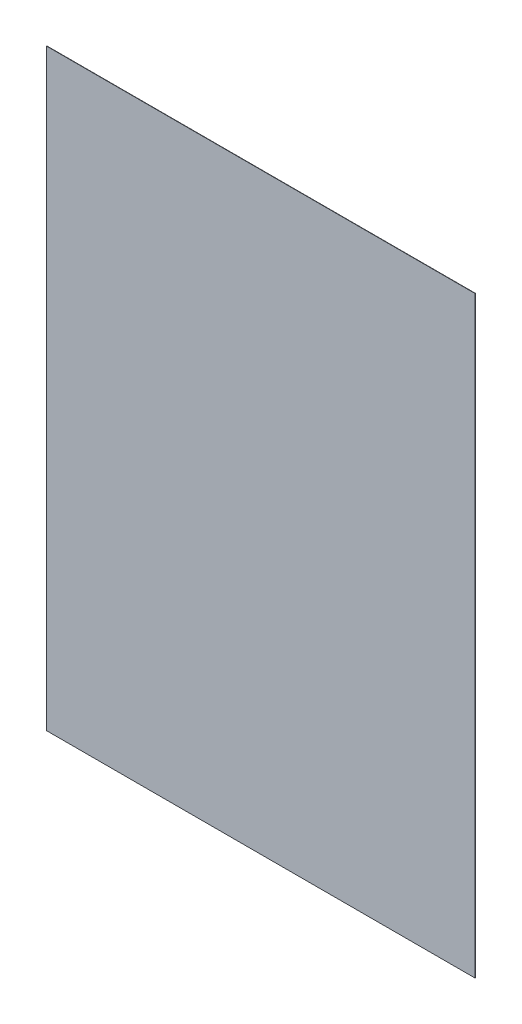
from build123d import *

# Parameters (mm, degrees)
SZKIC1_W               = 1300
SZKIC1_H               = 1800
ODGI_CIE_BAZOWE1_DEPTH = 1


# Sheet-metal steps are written as plain solids
with BuildPart() as part:
    # Szkic1 → Odgięcie bazowe1 (new body)
    with BuildSketch(Plane.XY):
        with Locations((650, 900)):
            Rectangle(SZKIC1_W, SZKIC1_H)
    extrude(amount=-ODGI_CIE_BAZOWE1_DEPTH)


solid = part.part
